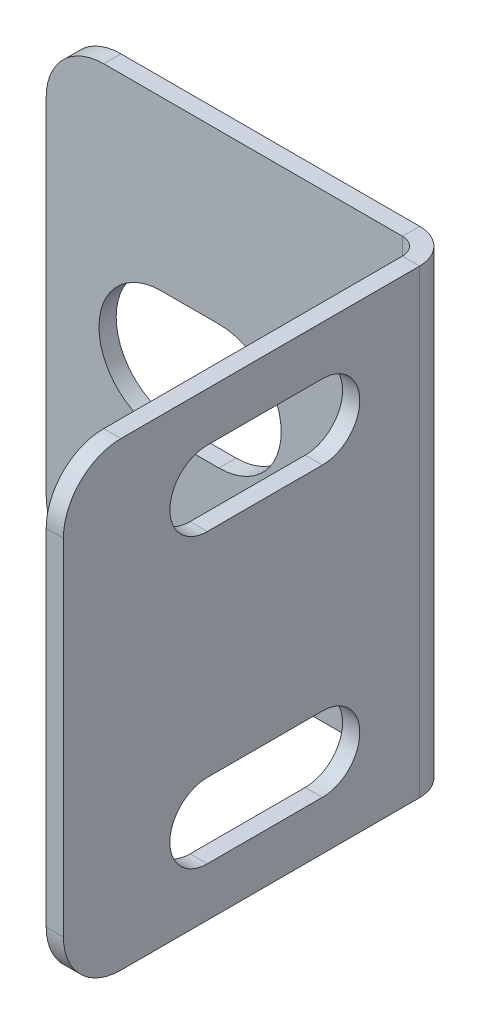
from build123d import *

# Parameters (mm, degrees)
SKETCH1_W                = 33.02
SKETCH1_H                = 20.32
BOSS_EXTRUDE1_DEPTH      = 0.75946
M3_SLOTS_REACH           = 24.731
M5_SLOT_REACH            = 24.731
FILLET1_R                = 2.54
SKETCHED_START           = -3.237390165
SKETCHED_BEND1_OUTLINE_W = 20.32
SKETCHED_BEND1_OUTLINE_H = 0.75946
SKETCHED_BEND1_DEPTH     = 15.937390165
SKETCHED_START_2         = -3.83615356
SKETCHED_BEND1_2_DEPTH   = 0.10270916
SKETCHED_START_3         = -4.59815356
SKETCHED_BEND1_3_DEPTH   = 1.52146
SKETCHED_START_4         = -10.16
SKETCHED_BEND1_4_DEPTH   = 20.32


with BuildPart() as part:
    # Sketch1 → Boss-Extrude1 (new body)
    with BuildSketch(Plane.XY):
        with Locations((-3.81, 0)):
            Rectangle(SKETCH1_W, SKETCH1_H)
    extrude(amount=BOSS_EXTRUDE1_DEPTH)

    # Sketch4 → M3 Slots (cut, up to next)
    with BuildSketch(Plane.XY.offset(0.75946), mode=Mode.PRIVATE) as m3_slots_sk1:
        with BuildLine():
            Line((1.27, 8), (6.35, 8))
            ThreePointArc((6.35, 8), (8, 6.35), (6.35, 4.7))
            Line((6.35, 4.7), (1.27, 4.7))
            ThreePointArc((1.27, 4.7), (-0.38, 6.35), (1.27, 8))
        make_face()
    m3_slots_tool1 = extrude(m3_slots_sk1.sketch, amount=-M3_SLOTS_REACH, mode=Mode.PRIVATE) & part.part
    # Sketch4 → M3 Slots (cut, up to next)
    with BuildSketch(Plane.XY.offset(0.75946), mode=Mode.PRIVATE) as m3_slots_sk2:
        with BuildLine():
            Line((1.27, -4.7), (6.35, -4.7))
            ThreePointArc((6.35, -4.7), (8, -6.35), (6.35, -8))
            Line((6.35, -8), (1.27, -8))
            ThreePointArc((1.27, -8), (-0.38, -6.35), (1.27, -4.7))
        make_face()
    m3_slots_tool2 = extrude(m3_slots_sk2.sketch, amount=-M3_SLOTS_REACH, mode=Mode.PRIVATE) & part.part
    add(m3_slots_tool1.solids().sort_by_distance((3.81, 6.35, 0.75946))[0], mode=Mode.SUBTRACT)
    add(m3_slots_tool2.solids().sort_by_distance((3.81, -6.35, 0.75946))[0], mode=Mode.SUBTRACT)

    # Sketch5 → M5 Slot (cut, up to next)
    with BuildSketch(Plane.XY.offset(0.75946), mode=Mode.PRIVATE) as m5_slot_sk1:
        with BuildLine():
            Line((-15.24, 2.75), (-12.7, 2.75))
            ThreePointArc((-12.7, 2.75), (-9.95, 0), (-12.7, -2.75))
            Line((-12.7, -2.75), (-15.24, -2.75))
            ThreePointArc((-15.24, -2.75), (-17.99, 0), (-15.24, 2.75))
        make_face()
    m5_slot_tool1 = extrude(m5_slot_sk1.sketch, amount=-M5_SLOT_REACH, mode=Mode.PRIVATE) & part.part
    add(m5_slot_tool1.solids().sort_by_distance((-13.97, 0, 0.75946))[0], mode=Mode.SUBTRACT)

    # Fillet1
    fillet1_edges = [part.edges().sort_by_distance(p)[0] for p in [
        (-20.32, -10.16, 0.37973),
        (-20.32, 10.16, 0.37973),
        (12.7, 10.16, 0.37973),
        (12.7, -10.16, 0.37973),
    ]]
    fillet(fillet1_edges, radius=FILLET1_R)

    # Sketched Bend1: read off the stored shape, not the designer's step
    # Sketched Bend1 outline → Sketched Bend1 (cut)
    with BuildSketch(Plane.YZ.offset(SKETCHED_START)):
        with Locations((0, 0.37973)):
            Rectangle(SKETCHED_BEND1_OUTLINE_W, SKETCHED_BEND1_OUTLINE_H)
    extrude(amount=SKETCHED_BEND1_DEPTH, mode=Mode.SUBTRACT)

    # Sketched Bend1 2 outline → Sketched Bend1 2 (add)
    with BuildSketch(Plane.YZ.offset(SKETCHED_START_2)):
        with BuildLine():
            Line((7.62, 17.24330644), (-7.62, 17.24330644))
            ThreePointArc((-7.62, 17.24330644), (-9.416051224, 16.499357664), (-10.16, 14.70330644))
            Line((-10.16, 14.70330644), (-10.16, 0.75946))
            Line((-10.16, 0.75946), (10.16, 0.75946))
            Line((10.16, 0.75946), (10.16, 14.70330644))
            ThreePointArc((10.16, 14.70330644), (9.416051224, 16.499357664), (7.62, 17.24330644))
        make_face()
        with BuildLine():
            ThreePointArc((-8, 10.89330644), (-6.35, 12.54330644), (-4.7, 10.89330644))
            Line((-4.7, 10.89330644), (-4.7, 5.81330644))
            ThreePointArc((-4.7, 5.81330644), (-6.35, 4.16330644), (-8, 5.81330644))
            Line((-8, 5.81330644), (-8, 10.89330644))
        make_face(mode=Mode.SUBTRACT)
        with BuildLine():
            ThreePointArc((4.7, 10.89330644), (6.35, 12.54330644), (8, 10.89330644))
            Line((8, 10.89330644), (8, 5.81330644))
            ThreePointArc((8, 5.81330644), (6.35, 4.16330644), (4.7, 5.81330644))
            Line((4.7, 5.81330644), (4.7, 10.89330644))
        make_face(mode=Mode.SUBTRACT)
    extrude(amount=SKETCHED_BEND1_2_DEPTH)

    # Sketched Bend1 3 outline → Sketched Bend1 3 (add)
    with BuildSketch(Plane.YZ.offset(SKETCHED_START_3)):
        with BuildLine():
            Line((7.62, 17.24330644), (-7.62, 17.24330644))
            ThreePointArc((-7.62, 17.24330644), (-9.416051224, 16.499357664), (-10.16, 14.70330644))
            Line((-10.16, 14.70330644), (-10.16, 0.75946))
            Line((-10.16, 0.75946), (10.16, 0.75946))
            Line((10.16, 0.75946), (10.16, 14.70330644))
            ThreePointArc((10.16, 14.70330644), (9.416051224, 16.499357664), (7.62, 17.24330644))
        make_face()
        with BuildLine():
            ThreePointArc((-8, 10.89330644), (-6.35, 12.54330644), (-4.7, 10.89330644))
            Line((-4.7, 10.89330644), (-4.7, 5.81330644))
            ThreePointArc((-4.7, 5.81330644), (-6.35, 4.16330644), (-8, 5.81330644))
            Line((-8, 5.81330644), (-8, 10.89330644))
        make_face(mode=Mode.SUBTRACT)
        with BuildLine():
            ThreePointArc((4.7, 10.89330644), (6.35, 12.54330644), (8, 10.89330644))
            Line((8, 10.89330644), (8, 5.81330644))
            ThreePointArc((8, 5.81330644), (6.35, 4.16330644), (4.7, 5.81330644))
            Line((4.7, 5.81330644), (4.7, 10.89330644))
        make_face(mode=Mode.SUBTRACT)
    extrude(amount=SKETCHED_BEND1_3_DEPTH)

    # Sketched Bend1 4 outline → Sketched Bend1 4 (cut)
    with BuildSketch(Plane(origin=(0, 0, 0), x_dir=(1, 0, 0), z_dir=(0, 1, 0)).offset(SKETCHED_START_4)):
        with BuildLine():
            Line((-4.59815356, -17.24330644), (-3.83615356, -17.24330644))
            Line((-3.83615356, -17.24330644), (-3.83615356, -1.52146))
            ThreePointArc((-3.83615356, -1.52146), (-4.059338193, -0.982644633), (-4.59815356, -0.75946))
            Line((-4.59815356, -0.75946), (-4.59815356, -17.24330644))
        make_face()
        with BuildLine():
            ThreePointArc((-4.59815356, 0), (-3.522318877, -0.445625317), (-3.07669356, -1.52146))
            Line((-3.07669356, -1.52146), (-3.07669356, -0.75946))
            Line((-3.07669356, -0.75946), (-3.237390165, -0.75946))
            Line((-3.237390165, -0.75946), (-3.237390165, 0))
            Line((-3.237390165, 0), (-4.59815356, 0))
        make_face()
    extrude(amount=SKETCHED_BEND1_4_DEPTH, mode=Mode.SUBTRACT)


solid = part.part
